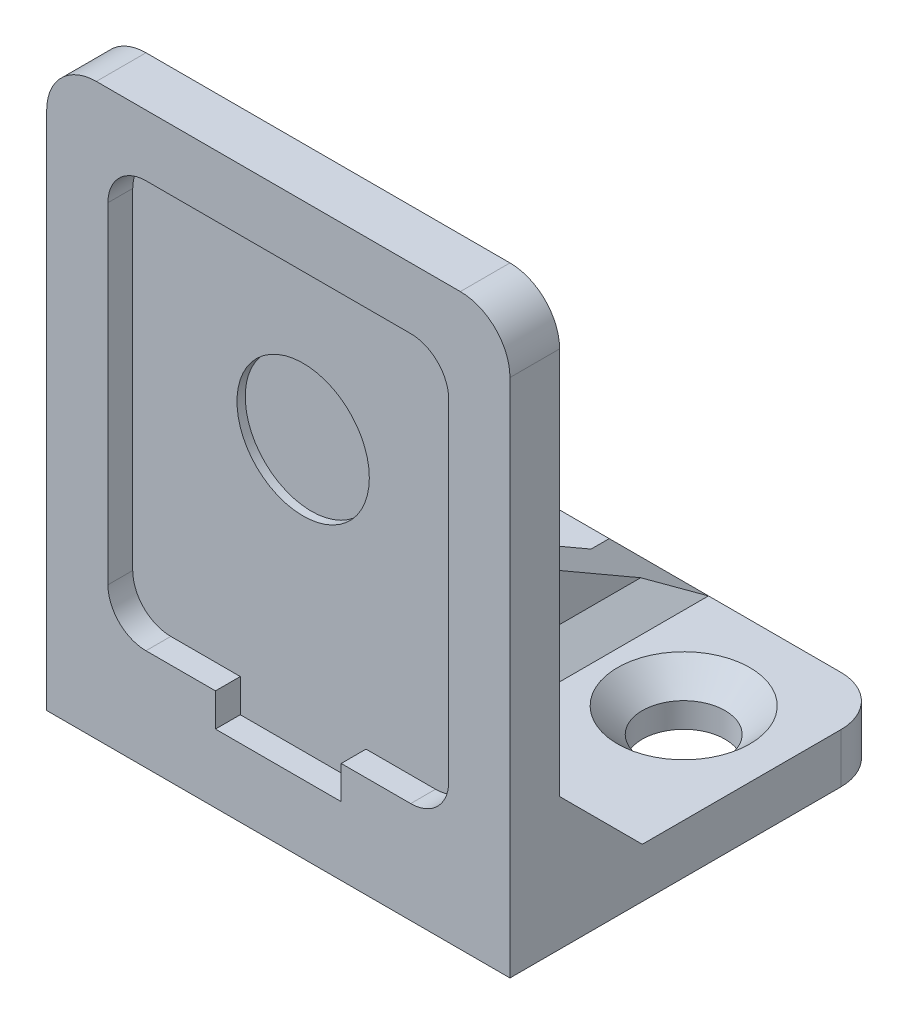
from build123d import *

# Parameters (mm, degrees)
ESBO_O2_W                = 28
ESBO_O2_H                = 34.43
RESSALTO_EXTRUS_O1_DEPTH = 3
FILETE1_R                = 3
RESSALTO_EXTRUS_O2_START = -1.5
RESSALTO_EXTRUS_O2_DEPTH = 1.5
ESBO_O5_W                = 28
ESBO_O5_H                = 3
RESSALTO_EXTRUS_O3_DEPTH = 20
ESBO_O6_R                = 2.5
CORTE_EXTRUS_O1_DEPTH    = 10
FILETE2_R                = 3
RESSALTO_EXTRUS_O4_DEPTH = 1.5
CHANFRO1_SIZE            = 1.5
CHANFRO2_SIZE            = 1.5
ESBO_O8_R                = 4
CORTE_EXTRUS_O2_DEPTH    = 0.5
CHANFRO3_SIZE            = 5
ESBO_O9_W                = 3
ESBO_O9_H                = 31.43
RESSALTO_EXTRUS_O5_DEPTH = 0.5
CHANFRO4_SIZE            = 0.5


with BuildPart() as part:
    # Esboço2 → Ressalto-extrusão1 (new body)
    with BuildSketch(Plane.XY):
        with Locations((0.050363351, 1.373235294)):
            Rectangle(ESBO_O2_W, ESBO_O2_H)
        with BuildLine():
            Line((8.050363351, 14.888235294), (-7.949636649, 14.888235294))
            ThreePointArc((-7.949636649, 14.888235294), (-9.575982246, 14.214580891), (-10.249636649, 12.588235294))
            Line((-10.249636649, 12.588235294), (-10.249636649, -7.411764706))
            ThreePointArc((-10.249636649, -7.411764706), (-9.575982246, -9.038110303), (-7.949636649, -9.711764706))
            Line((-7.949636649, -9.711764706), (-3.749636649, -9.711764706))
            Line((-3.749636649, -9.711764706), (-3.749636649, -11.711764706))
            Line((-3.749636649, -11.711764706), (3.850363351, -11.711764706))
            Line((3.850363351, -11.711764706), (3.850363351, -9.711764706))
            Line((3.850363351, -9.711764706), (8.050363351, -9.711764706))
            ThreePointArc((8.050363351, -9.711764706), (9.676708947, -9.038110303), (10.350363351, -7.411764706))
            Line((10.350363351, -7.411764706), (10.350363351, 12.588235294))
            ThreePointArc((10.350363351, 12.588235294), (9.676708947, 14.214580891), (8.050363351, 14.888235294))
        make_face(mode=Mode.SUBTRACT)
    extrude(amount=RESSALTO_EXTRUS_O1_DEPTH)

    # Filete1
    filete1_edges = [part.edges().sort_by_distance(p)[0] for p in [
        (-13.949636649, 18.588235294, 1.5),
        (14.050363351, 18.588235294, 1.5),
    ]]
    fillet(filete1_edges, radius=FILETE1_R)

    # Esboço3 → Ressalto-extrusão2 (add)
    with BuildSketch(Plane(origin=(0, 0, 0), x_dir=(-1, 0, 0), z_dir=(0, 0, -1)).offset(RESSALTO_EXTRUS_O2_START)):
        with BuildLine():
            Line((13.949636649, 15.588235294), (13.949636649, -15.841764706))
            Line((13.949636649, -15.841764706), (-14.050363351, -15.841764706))
            Line((-14.050363351, -15.841764706), (-14.050363351, 15.588235294))
            ThreePointArc((-14.050363351, 15.588235294), (-13.171683694, 17.709555638), (-11.050363351, 18.588235294))
            Line((-11.050363351, 18.588235294), (10.949636649, 18.588235294))
            ThreePointArc((10.949636649, 18.588235294), (13.070956993, 17.709555638), (13.949636649, 15.588235294))
        make_face()
    extrude(amount=RESSALTO_EXTRUS_O2_DEPTH)

    # Esboço5 → Ressalto-extrusão3 (add)
    with BuildSketch(Plane(origin=(0, 0, 0), x_dir=(-1, 0, 0), z_dir=(0, 0, -1))):
        with Locations((-0.050363351, -14.341764706)):
            Rectangle(ESBO_O5_W, ESBO_O5_H)
    extrude(amount=RESSALTO_EXTRUS_O3_DEPTH)

    # Esboço6 → Corte-extrusão1 (cut)
    with BuildSketch(Plane(origin=(0, -12.841764706, 0), x_dir=(1, 0, 0), z_dir=(0, 1, 0))):
        with Locations(Location((-7.949636649, 13.5, 0), (0, 0, 180))):
            Circle(ESBO_O6_R)
        with Locations(Location((8.050363351, 13.5, 0), (0, 0, 180))):
            Circle(ESBO_O6_R)
    extrude(amount=-CORTE_EXTRUS_O1_DEPTH, mode=Mode.SUBTRACT)

    # Filete2
    filete2_edges = [part.edges().sort_by_distance(p)[0] for p in [
        (14.050363351, -14.341764706, -20),
        (-13.949636649, -14.341764706, -20),
    ]]
    fillet(filete2_edges, radius=FILETE2_R)

    # Esboço7 → Ressalto-extrusão4 (add, symmetric)
    with BuildSketch(Plane(origin=(0.050363351, 0, 0), x_dir=(0, 0, -1), z_dir=(1, 0, 0))):
        Polygon((0, -1.294759322), (0, -12.841764706), (20, -12.841764706), align=None)
    extrude(amount=RESSALTO_EXTRUS_O4_DEPTH, both=True)

    # Chanfro1
    # the kernel refuses this chamfer: 1.5 mm, written as the material it adds along each edge
    with BuildSketch(Plane(origin=(-1.449636649, -12.841764706, 3.857524482), x_dir=(-0.9996219169112968, -0.027495876610586813, 0), z_dir=(0, 0, -1))) as chanfro1_piece_1_section:
        Polygon((CHANFRO1_SIZE * 0.999621916911, CHANFRO1_SIZE * 0.0274958766106), (-CHANFRO1_SIZE * 0.0274958766106, CHANFRO1_SIZE * 0.999621916911), (0, 0), align=None)
    chanfro1_piece_1 = extrude(amount=27.715048964, mode=Mode.PRIVATE)
    chanfro1_piece_1 = split(chanfro1_piece_1, bisect_by=Plane(origin=(-1.978250847, -8.234905434, -12.020685678), z_dir=(0, -0.8660254037844417, 0.4999999999999947)), keep=Keep.TOP, mode=Mode.PRIVATE)
    chanfro1_piece_1 = split(chanfro1_piece_1, bisect_by=Plane(origin=(-1.978250847, -12.398993102, 1.5), z_dir=(0, 0, -1)), keep=Keep.TOP, mode=Mode.PRIVATE)
    add(chanfro1_piece_1)
    with BuildSketch(Plane(origin=(-1.449636649, 2.56276516, 0), x_dir=(-0.9996219169112969, 0, 0.027495876610586372), z_dir=(0, -1, 0))) as chanfro1_piece_2_section:
        Polygon((CHANFRO1_SIZE * 0.999621916911, CHANFRO1_SIZE * 0.0274958766106), (-CHANFRO1_SIZE * 0.0274958766106, CHANFRO1_SIZE * 0.999621916911), (0, 0), align=None)
    chanfro1_piece_2 = extrude(amount=19.262054348, mode=Mode.PRIVATE)
    chanfro1_piece_2 = split(chanfro1_piece_2, bisect_by=Plane(origin=(-1.952841778, -15.841764706, -0.493589744), z_dir=(0, 1, 0)), keep=Keep.TOP, mode=Mode.PRIVATE)
    chanfro1_piece_2 = split(chanfro1_piece_2, bisect_by=Plane(origin=(-1.952841778, -2.987487395, -2.931891026), z_dir=(0, -0.8660254037844417, 0.4999999999999947)), keep=Keep.TOP, mode=Mode.PRIVATE)
    add(chanfro1_piece_2)
    with BuildSketch(Plane(origin=(1.550363351, -12.841764706, 3.857524482), x_dir=(-0.02749587661058648, 0.9996219169112968, 0), z_dir=(0, 0, -1))) as chanfro1_piece_3_section:
        Polygon((CHANFRO1_SIZE * 0.999621916911, CHANFRO1_SIZE * 0.0274958766106), (-CHANFRO1_SIZE * 0.0274958766106, CHANFRO1_SIZE * 0.999621916911), (0, 0), align=None)
    chanfro1_piece_3 = extrude(amount=27.715048964, mode=Mode.PRIVATE)
    chanfro1_piece_3 = split(chanfro1_piece_3, bisect_by=Plane(origin=(1.674066113, -7.728766139, -11.144026704), z_dir=(0, -0.8660254037844417, 0.4999999999999947)), keep=Keep.TOP, mode=Mode.PRIVATE)
    chanfro1_piece_3 = split(chanfro1_piece_3, bisect_by=Plane(origin=(1.674066113, -11.58917023, 1.5), z_dir=(0, 0, -1)), keep=Keep.TOP, mode=Mode.PRIVATE)
    add(chanfro1_piece_3)
    with BuildSketch(Plane(origin=(1.550363351, 2.56276516, 0), x_dir=(0.9996219169112969, 0, 0.027495876610586372), z_dir=(0, -1, 0))) as chanfro1_piece_4_section:
        Polygon((CHANFRO1_SIZE * 0.999621916911, -CHANFRO1_SIZE * 0.0274958766106), (-CHANFRO1_SIZE * 0.0274958766106, -CHANFRO1_SIZE * 0.999621916911), (0, 0), align=None)
    chanfro1_piece_4 = extrude(amount=15.404529866, mode=Mode.PRIVATE)
    chanfro1_piece_4 = split(chanfro1_piece_4, bisect_by=Plane(origin=(2.053568479, -2.987487395, -2.931891026), z_dir=(0, -0.8660254037844417, 0.4999999999999947)), keep=Keep.TOP, mode=Mode.PRIVATE)
    add(chanfro1_piece_4)

    # Chanfro2
    chanfro2_edges = [part.edges().sort_by_distance(p)[0] for p in [
        (-5.449636649, -12.841764706, -13.5),
        (10.550363351, -12.841764706, -13.5),
    ]]
    chamfer(chanfro2_edges, length=CHANFRO2_SIZE)

    # Esboço8 → Corte-extrusão2 (cut)
    with BuildSketch(Plane.XY.offset(1.5)):
        with Locations((0.050363351, 4.588235294)):
            Circle(ESBO_O8_R)
    extrude(amount=-CORTE_EXTRUS_O2_DEPTH, mode=Mode.SUBTRACT)

    # Chanfro3
    # the kernel refuses this chamfer: 5 mm, written as the material it adds along each edge
    with BuildSketch(Plane(origin=(-13.949636649, -12.841764706, 0), x_dir=(0, -0.027495876610586317, -0.9996219169112968), z_dir=(1, 0, 0))) as chanfro3_piece_1:
        Polygon((CHANFRO3_SIZE * 0.999621916911, CHANFRO3_SIZE * 0.0274958766106), (-CHANFRO3_SIZE * 0.0274958766106, CHANFRO3_SIZE * 0.999621916911), (0, 0), align=None)
    extrude(amount=23.85841494)
    with BuildSketch(Plane(origin=(-9.808051589, -12.841764706, 0), x_dir=(0, 0.9996219169112968, 0.027495876610586372), z_dir=(1, 0, 0))) as chanfro3_piece_2:
        Polygon((CHANFRO3_SIZE * 0.999621916911, -CHANFRO3_SIZE * 0.0274958766106), (-CHANFRO3_SIZE * 0.0274958766106, -CHANFRO3_SIZE * 0.999621916911), (0, 0), align=None)
    extrude(amount=23.85841494)

    # Esboço9 → Ressalto-extrusão5 (add)
    with BuildSketch(Plane(origin=(0, 0, 0), x_dir=(-1, 0, 0), z_dir=(0, 0, -1))):
        with Locations((-8.050363351, 2.873235294)):
            Rectangle(ESBO_O9_W, ESBO_O9_H)
        with Locations((7.949636649, 2.873235294)):
            Rectangle(ESBO_O9_W, ESBO_O9_H)
    extrude(amount=RESSALTO_EXTRUS_O5_DEPTH)

    # Chanfro4
    chanfro4_edges = [part.edges().sort_by_distance(p)[0] for p in [
        (-7.949636649, 18.588235294, -0.5),
        (8.050363351, 18.588235294, -0.5),
    ]]
    chamfer(chanfro4_edges, length=CHANFRO4_SIZE)


solid = part.part
